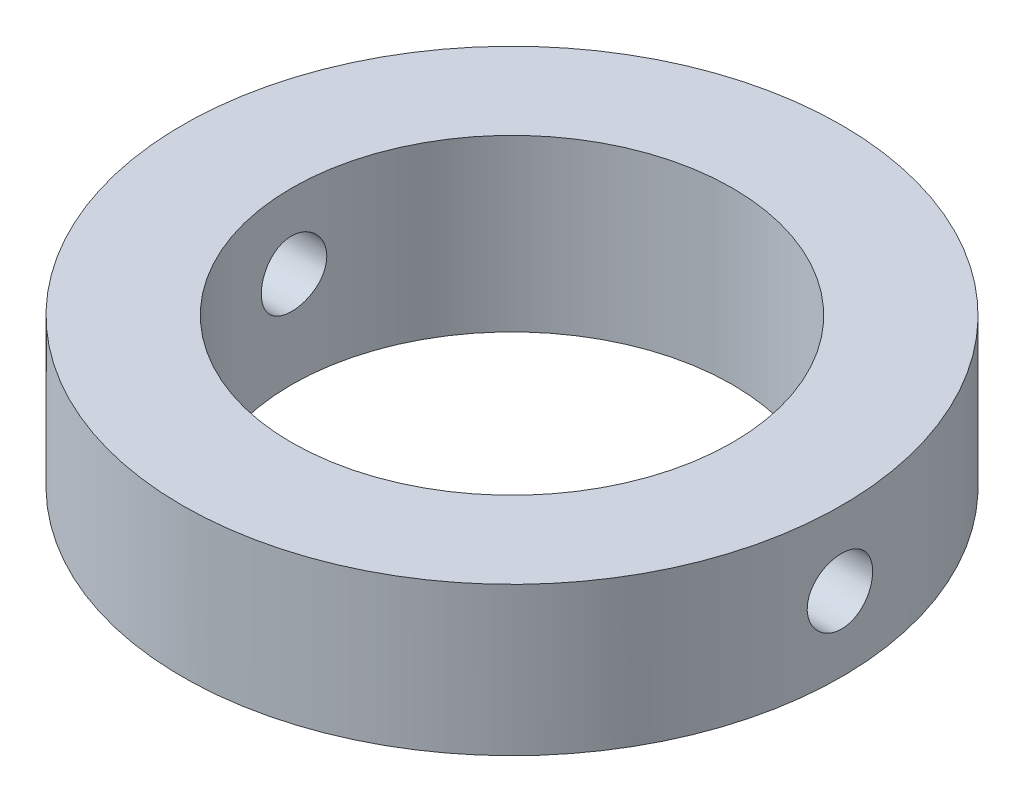
from build123d import *

# Parameters (mm, degrees)
SKETCH1_R               = 15.1
SKETCH1_R_2             = 10.1
BOSS_EXTRUDE1_DEPTH     = 7
CUT_EXTRUDE3_DEPTH      = 22
CUT_EXTRUDE3_DEPTH_BACK = 24
SKETCH2_R               = 1.5
SKETCH4_R               = 23.353820798
SKETCH4_R_2             = 11.1
CUT_EXTRUDE4_DEPTH      = 1
SKETCH6_R               = 15.1
SKETCH6_R_2             = 10.1
BOSS_EXTRUDE2_DEPTH     = 0.8


with BuildPart() as part:
    # Sketch1 → Boss-Extrude1 (new body)
    with BuildSketch(Plane(origin=(0, 0, 0), x_dir=(1, 0, 0), z_dir=(0, 1, 0))):
        Circle(SKETCH1_R)
        Circle(SKETCH1_R_2, mode=Mode.SUBTRACT)
    extrude(amount=BOSS_EXTRUDE1_DEPTH)

    # Sketch2 → Cut-Extrude3 (cut, two sides: drawn at the far end of the back side and taken through both)
    with BuildSketch(Plane(origin=(0, 0, 0), x_dir=(0, 0, -1), z_dir=(1, 0, 0)).offset(-CUT_EXTRUDE3_DEPTH_BACK)):
        with Locations((0, 4.401951984)):
            Circle(SKETCH2_R)
    extrude(amount=CUT_EXTRUDE3_DEPTH + CUT_EXTRUDE3_DEPTH_BACK, mode=Mode.SUBTRACT)

    # Sketch4 → Cut-Extrude4 (cut)
    with BuildSketch(Plane.XZ):
        Circle(SKETCH4_R)
        Circle(SKETCH4_R_2, mode=Mode.SUBTRACT)
    extrude(amount=-CUT_EXTRUDE4_DEPTH, mode=Mode.SUBTRACT)

    # Sketch6 → Boss-Extrude2 (add)
    with BuildSketch(Plane(origin=(0, 7, 0), x_dir=(1, 0, 0), z_dir=(0, 1, 0))):
        Circle(SKETCH6_R)
        Circle(SKETCH6_R_2, mode=Mode.SUBTRACT)
    extrude(amount=BOSS_EXTRUDE2_DEPTH)


solid = part.part
